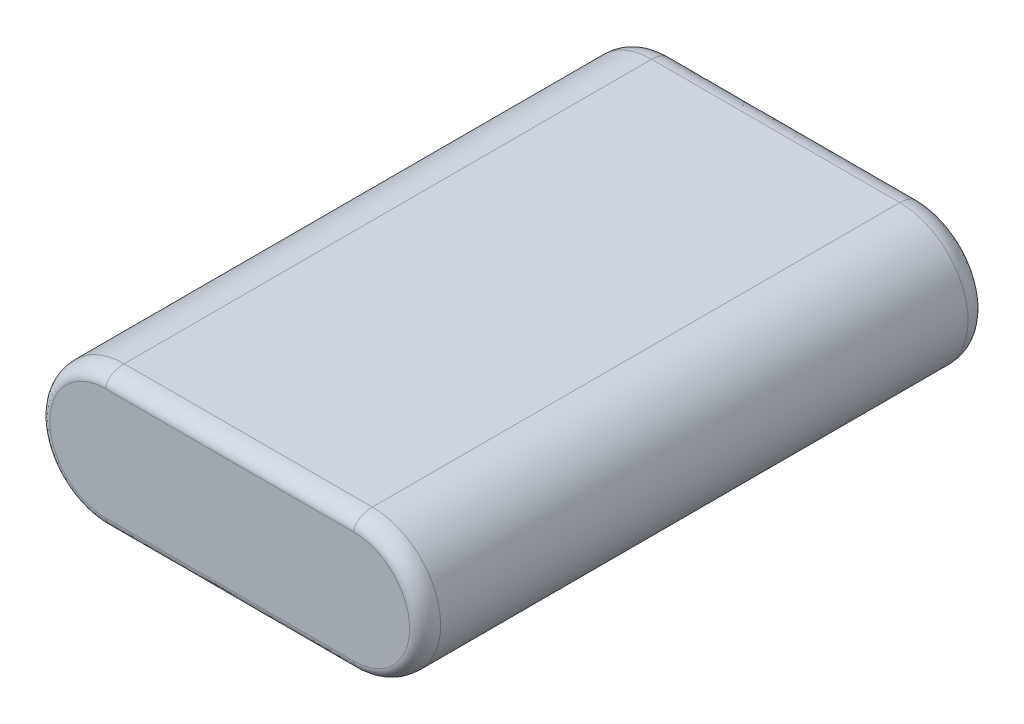
from build123d import *

# Parameters (mm, degrees)
EXTRUDE_1_DEPTH = 91
FILLET_1_SIZE   = 3
FILLET_1_SIZE_2 = 2
FILLET_2_SIZE   = 3
FILLET_2_SIZE_2 = 2


with BuildPart() as part:
    # ｽｹｯﾁ1 → ﾎﾞｽ - 押し出し1 (new body)
    with BuildSketch(Plane.XY):
        with BuildLine():
            Line((20, -11), (-20, -11))
            ThreePointArc((-20, -11), (-31, 0), (-20, 11))
            Line((-20, 11), (20, 11))
            ThreePointArc((20, 11), (31, 0), (20, -11))
        make_face()
    extrude(amount=EXTRUDE_1_DEPTH)

    # ﾌｨﾚｯﾄ1
    # an asymmetric fillet: 3, 2 mm, written as the material it takes off along each edge
    with BuildSketch(Plane(origin=(20, -11, 91), x_dir=(0, 0, -1), z_dir=(-1, 0, 0)), Plane(origin=(-20, 11, 91), x_dir=(0, 0, -1), z_dir=(1, 0, 0))) as fillet_1_piece_1:
        with BuildLine():
            Bezier((FILLET_1_SIZE, 0), (0, 0), (0, -FILLET_1_SIZE_2), weights=[1, 0.707106781, 1])
            Line((0, -FILLET_1_SIZE_2), (0, 0))
            Line((0, 0), (FILLET_1_SIZE, 0))
        make_face()
    extrude(amount=40, mode=Mode.SUBTRACT)
    with BuildSketch(Plane(origin=(20, 0, 91), x_dir=(0, 1, 0), z_dir=(-1, 0, 0))) as fillet_1_piece_2:
        with BuildLine():
            Bezier((11, FILLET_1_SIZE), (11, 0), (11 - FILLET_1_SIZE_2, 0), weights=[1, 0.707106781, 1])
            Line((11 - FILLET_1_SIZE_2, 0), (11, 0))
            Line((11, 0), (11, FILLET_1_SIZE))
        make_face()
    revolve(axis=Axis((20, 0, 91), (0, 0, -1)), revolution_arc=180, mode=Mode.SUBTRACT)
    with BuildSketch(Plane(origin=(-20, 0, 91), x_dir=(0, -1, 0), z_dir=(1, 0, 0))) as fillet_1_piece_3:
        with BuildLine():
            Bezier((11, FILLET_1_SIZE), (11, 0), (11 - FILLET_1_SIZE_2, 0), weights=[1, 0.707106781, 1])
            Line((11 - FILLET_1_SIZE_2, 0), (11, 0))
            Line((11, 0), (11, FILLET_1_SIZE))
        make_face()
    revolve(axis=Axis((-20, 0, 91), (0, 0, -1)), revolution_arc=180, mode=Mode.SUBTRACT)

    # ﾌｨﾚｯﾄ2
    # an asymmetric fillet: 3, 2 mm, written as the material it takes off along each edge
    with BuildSketch(Plane(origin=(20, -11, 0), x_dir=(0, 0, 1), z_dir=(-1, 0, 0))) as fillet_2_piece_1:
        with BuildLine():
            Bezier((FILLET_2_SIZE, 0), (0, 0), (0, FILLET_2_SIZE_2), weights=[1, 0.707106781, 1])
            Line((0, FILLET_2_SIZE_2), (0, 0))
            Line((0, 0), (FILLET_2_SIZE, 0))
        make_face()
    extrude(amount=40, mode=Mode.SUBTRACT)
    with BuildSketch(Plane(origin=(-20, 0, 0), x_dir=(0, -1, 0), z_dir=(1, 0, 0))) as fillet_2_piece_2:
        with BuildLine():
            Bezier((11 - FILLET_2_SIZE_2, 0), (11, 0), (11, -FILLET_2_SIZE), weights=[1, 0.707106781, 1])
            Line((11, -FILLET_2_SIZE), (11, 0))
            Line((11, 0), (11 - FILLET_2_SIZE_2, 0))
        make_face()
    revolve(axis=Axis((-20, 0, 0), (0, 0, -1)), revolution_arc=180, mode=Mode.SUBTRACT)
    with BuildSketch(Plane(origin=(-20, 11, 0), x_dir=(0, -1, 0), z_dir=(1, 0, 0))) as fillet_2_piece_3:
        with BuildLine():
            Bezier((FILLET_2_SIZE_2, 0), (0, 0), (0, -FILLET_2_SIZE), weights=[1, 0.707106781, 1])
            Line((0, -FILLET_2_SIZE), (0, 0))
            Line((0, 0), (FILLET_2_SIZE_2, 0))
        make_face()
    extrude(amount=40, mode=Mode.SUBTRACT)
    with BuildSketch(Plane(origin=(20, 0, 0), x_dir=(0, 1, 0), z_dir=(-1, 0, 0))) as fillet_2_piece_4:
        with BuildLine():
            Bezier((11 - FILLET_2_SIZE_2, 0), (11, 0), (11, -FILLET_2_SIZE), weights=[1, 0.707106781, 1])
            Line((11, -FILLET_2_SIZE), (11, 0))
            Line((11, 0), (11 - FILLET_2_SIZE_2, 0))
        make_face()
    revolve(axis=Axis((20, 0, 0), (0, 0, -1)), revolution_arc=180, mode=Mode.SUBTRACT)


solid = part.part
